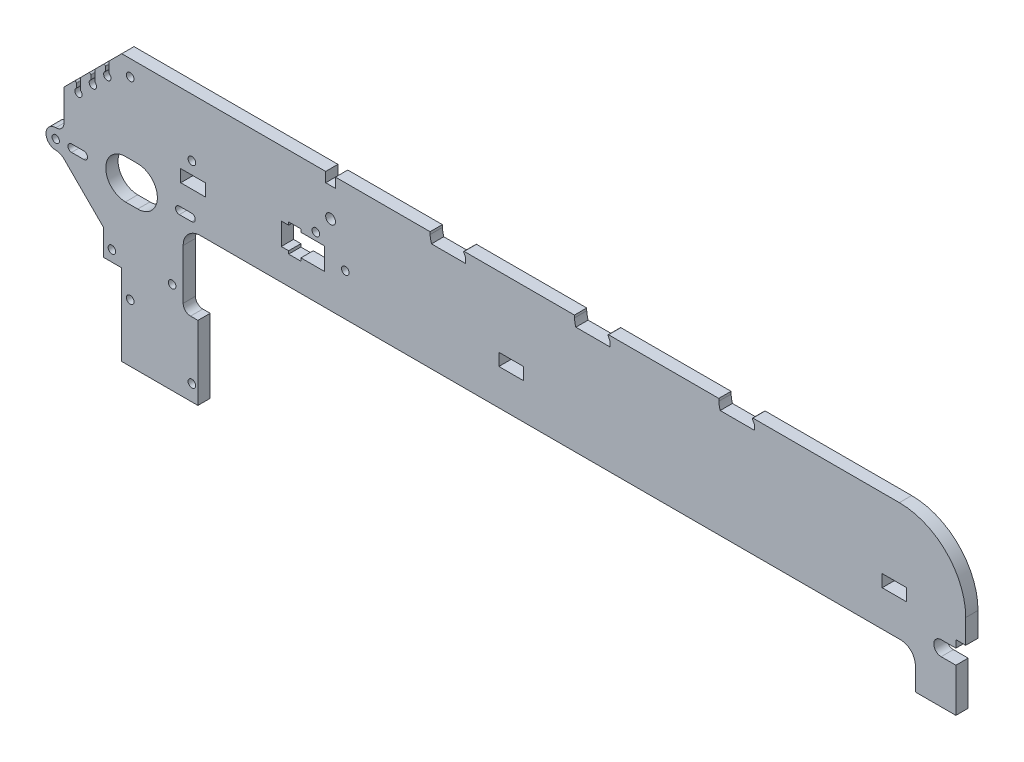
from build123d import *

# Parameters (mm, degrees)
SKETCH1_R           = 1.5
SKETCH1_R_2         = 8
SKETCH1_R_3         = 1.55
SKETCH1_R_4         = 2
SKETCH1_W           = 10
SKETCH1_H           = 5
BOSS_EXTRUDE1_DEPTH = 5
FILLET2_R           = 7
FILLET3_R           = 3
CUT_EXTRUDE1_DEPTH  = 344.247723955
FILLET4_R           = 6
CUT_EXTRUDE2_DEPTH  = 344.247723955
FILLET5_R           = 0.5


with BuildPart() as part:
    # Sketch1 → Boss-Extrude1 (new body)
    with BuildSketch(Plane.XY):
        with BuildLine():
            Line((310, 43.5), (250.404508497, 43.5))
            ThreePointArc((250.404508497, 43.5), (250.191845795, 43.381432778), (250.180901699, 43.138196601))
            Line((250.180901699, 43.138196601), (251, 41.5))
            Line((251, 41.5), (251, 39.5))
            Line((251, 39.5), (237.067482844, 39.5))
            ThreePointArc((237.067482844, 39.5), (236.698891369, 40.983949684), (236.5, 42.5))
            Line((236.5, 42.5), (236.5, 43.5))
            Line((236.5, 43.5), (191.654508497, 43.5))
            ThreePointArc((191.654508497, 43.5), (191.441845795, 43.381432778), (191.430901699, 43.138196601))
            Line((191.430901699, 43.138196601), (192.25, 41.5))
            Line((192.25, 41.5), (192.25, 39.5))
            Line((192.25, 39.5), (178.317482844, 39.5))
            ThreePointArc((178.317482844, 39.5), (177.948891369, 40.983949684), (177.75, 42.5))
            Line((177.75, 42.5), (177.75, 43.5))
            Line((177.75, 43.5), (132.904508497, 43.5))
            ThreePointArc((132.904508497, 43.5), (132.691845795, 43.381432778), (132.680901699, 43.138196601))
            Line((132.680901699, 43.138196601), (133.5, 41.5))
            Line((133.5, 41.5), (133.5, 39.5))
            Line((133.5, 39.5), (119.567482844, 39.5))
            ThreePointArc((119.567482844, 39.5), (119.198891369, 40.983949684), (119, 42.5))
            Line((119, 42.5), (119, 43.5))
            Line((119, 43.5), (80.5, 43.5))
            Line((80.5, 43.5), (80.5, 39.5))
            Line((80.5, 39.5), (76.5, 39.5))
            Line((76.5, 39.5), (76.5, 43.5))
            Line((76.5, 43.5), (-6.5, 43.5))
            Line((-6.5, 43.5), (-30, 20))
            Line((-30, 20), (-30, 7.325414703))
            ThreePointArc((-30, 7.325414703), (-30.985037822, 4.947323034), (-33.36312949, 3.962285212))
            ThreePointArc((-33.36312949, 3.962285212), (-37.325414703, 0), (-33.36312949, -3.962285212))
            ThreePointArc((-33.36312949, -3.962285212), (-31.543016926, -4.324328111), (-30, -5.355339059))
            Line((-30, -5.355339059), (-14, -21.355339059))
            Line((-14, -21.355339059), (-14, -32))
            Line((-14, -32), (-6.5, -32))
            Line((-6.5, -32), (-6.5, -65))
            Line((-6.5, -65), (24.5, -65))
            Line((24.5, -65), (24.5, -35))
            Line((24.5, -35), (18.5, -35))
            Line((18.5, -35), (18.5, -4.6))
            Line((18.5, -4.6), (316.5, -4.6))
            Line((316.5, -4.6), (316.5, -20))
            Line((316.5, -20), (333, -20))
            Line((333, -20), (333, -2.3))
            Line((333, -2.3), (327, -2.3))
            ThreePointArc((327, -2.3), (324, 0.7), (327, 3.7))
            Line((327, 3.7), (333, 3.7))
            Line((333, 3.7), (333, 6.7))
            Line((333, 6.7), (337, 6.7))
            Line((337, 6.7), (337, 16.5))
            ThreePointArc((337, 16.5), (329.091883092, 35.591883092), (310, 43.5))
        make_face()
        with Locations((21.920310217, 0)):
            Circle(SKETCH1_R, mode=Mode.SUBTRACT)
        with Locations((-21.920310217, 0)):
            Circle(SKETCH1_R, mode=Mode.SUBTRACT)
        Circle(SKETCH1_R_2, mode=Mode.SUBTRACT)
        with Locations((-3.05, 37)):
            Circle(SKETCH1_R_3, mode=Mode.SUBTRACT)
        with Locations((22.05, 20)):
            Circle(SKETCH1_R_3, mode=Mode.SUBTRACT)
        with Locations((-3.05, -41.5)):
            Circle(SKETCH1_R_3, mode=Mode.SUBTRACT)
        with Locations((22.05, -58.5)):
            Circle(SKETCH1_R_3, mode=Mode.SUBTRACT)
        with Locations((72.5, 20.1)):
            Circle(SKETCH1_R_3, mode=Mode.SUBTRACT)
        with Locations((84.5, 12.5)):
            Circle(SKETCH1_R_3, mode=Mode.SUBTRACT)
        with Locations((-10.5, -27.55)):
            Circle(SKETCH1_R_3, mode=Mode.SUBTRACT)
        with Locations((14, -27.55)):
            Circle(SKETCH1_R_3, mode=Mode.SUBTRACT)
        with Locations((-33.36312949, 0)):
            Circle(SKETCH1_R, mode=Mode.SUBTRACT)
        with Locations((78.5, 27.751425951)):
            Circle(SKETCH1_R_4, mode=Mode.SUBTRACT)
        with Locations((22.5, 12.5)):
            Rectangle(SKETCH1_W, SKETCH1_H, mode=Mode.SUBTRACT)
        with Locations((152, 12.5)):
            Rectangle(SKETCH1_W, SKETCH1_H, mode=Mode.SUBTRACT)
        with Locations((308, 12.5)):
            Rectangle(SKETCH1_W, SKETCH1_H, mode=Mode.SUBTRACT)
        Polygon((58.427680349, 8), (61.427680349, 8), (61.427680349, 6.806102344), (66.427680349, 6.806102344), (66.427680349, 8), (76, 8), (76, 17), (66.427680349, 17), (66.427680349, 18.193897656), (61.427680349, 18.193897656), (61.427680349, 17), (58.427680349, 17), align=None, mode=Mode.SUBTRACT)
    extrude(amount=BOSS_EXTRUDE1_DEPTH)

    # Fillet2
    fillet2_edges = [part.edges().sort_by_distance(p)[0] for p in [
        (18.5, -4.6, 2.5),
    ]]
    fillet(fillet2_edges, radius=FILLET2_R)

    # Fillet3
    fillet3_edges = [part.edges().sort_by_distance(p)[0] for p in [
        (18.5, -35, 2.5),
    ]]
    fillet(fillet3_edges, radius=FILLET3_R)

    # Sketch2 → Cut-Extrude1 (cut, through all)
    with BuildSketch(Plane.XY.offset(5)):
        with BuildLine():
            Line((21.920310217, -1.5), (16.920310217, -1.5))
            ThreePointArc((16.920310217, -1.5), (15.420310217, 0), (16.920310217, 1.5))
            Line((16.920310217, 1.5), (21.920310217, 1.5))
            ThreePointArc((21.920310217, 1.5), (23.420310217, 0), (21.920310217, -1.5))
        make_face()
        with BuildLine():
            Line((0, -8), (-5, -8))
            ThreePointArc((-5, -8), (-13, 0), (-5, 8))
            Line((-5, 8), (0, 8))
            ThreePointArc((0, 8), (8, 0), (0, -8))
        make_face()
        with BuildLine():
            Line((-21.920310217, -1.5), (-26.920310217, -1.5))
            ThreePointArc((-26.920310217, -1.5), (-28.420310217, 0), (-26.920310217, 1.5))
            Line((-26.920310217, 1.5), (-21.920310217, 1.5))
            ThreePointArc((-21.920310217, 1.5), (-20.420310217, 0), (-21.920310217, -1.5))
        make_face()
    extrude(amount=-CUT_EXTRUDE1_DEPTH, mode=Mode.SUBTRACT)

    # Fillet4
    fillet4_edges = [part.edges().sort_by_distance(p)[0] for p in [
        (316.5, -4.6, 2.5),
    ]]
    fillet(fillet4_edges, radius=FILLET4_R)

    # Sketch3 → Cut-Extrude2 (cut, through all)
    with BuildSketch(Plane.XY.offset(5)):
        with BuildLine():
            Line((-13.125, 42.835857073), (-11.625, 42.835857073))
            Line((-11.625, 42.835857073), (-11.625, 33.924038106))
            ThreePointArc((-11.625, 33.924038106), (-12.375, 31.125), (-13.125, 33.924038106))
            Line((-13.125, 33.924038106), (-13.125, 42.835857073))
        make_face()
        with BuildLine():
            Line((-17.4, 36.92183731), (-17.4, 27.985920709))
            ThreePointArc((-17.4, 27.985920709), (-18.25, 25.25), (-19.1, 27.985920709))
            Line((-19.1, 27.985920709), (-19.1, 36.92183731))
            Line((-19.1, 36.92183731), (-17.4, 36.92183731))
        make_face()
        with BuildLine():
            Line((-23.275, 31.04683731), (-23.275, 22.110920709))
            ThreePointArc((-23.275, 22.110920709), (-24.125, 19.375), (-24.975, 22.110920709))
            Line((-24.975, 22.110920709), (-24.975, 31.04683731))
            Line((-24.975, 31.04683731), (-23.275, 31.04683731))
        make_face()
    extrude(amount=-CUT_EXTRUDE2_DEPTH, mode=Mode.SUBTRACT)

    # Fillet5
    fillet5_edges = [part.edges().sort_by_distance(p)[0] for p in [
        (-24.975, 25.025, 2.5),
        (-19.1, 30.9, 2.5),
        (-13.125, 36.875, 2.5),
    ]]
    fillet(fillet5_edges, radius=FILLET5_R)


solid = part.part
